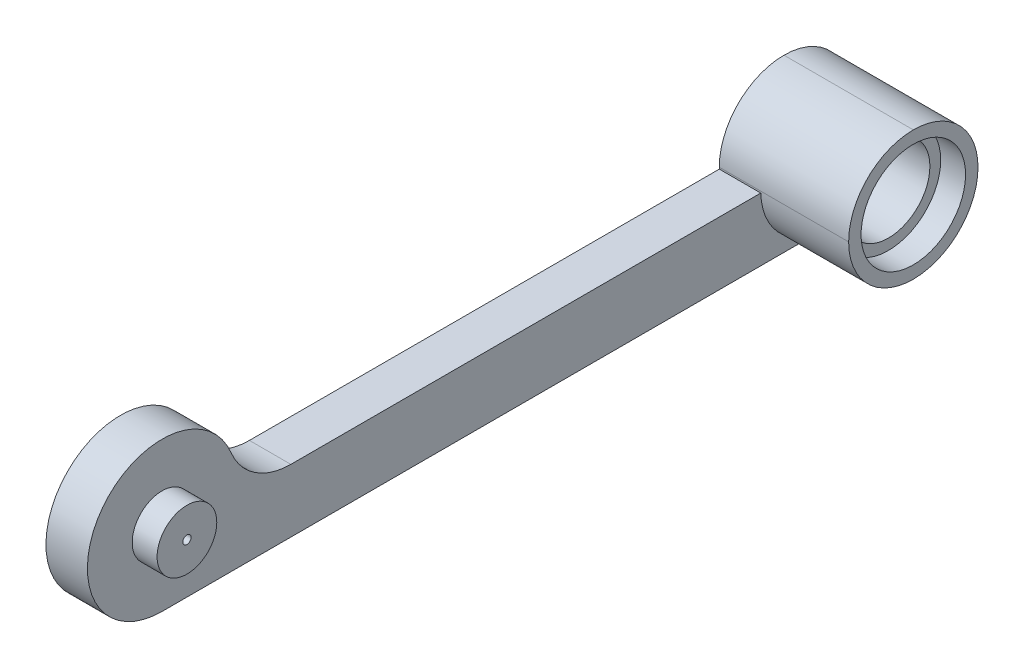
from build123d import *

# Parameters (mm, degrees)
SKETCH_1_R               = 4.5
SKETCH_1_W               = 43.9
SKETCH_1_H               = 7.8
EXTRUDE_1_DEPTH          = 2.5
EXTRUDE_START            = 2.5
SKETCH_1_6_R             = 1.8
SKETCH_1_6_R_2           = 0.25
EXTRUDE_3_DEPTH          = 1.5
SKETCH_1_5_W             = 7.8
SKETCH_1_5_H             = 7.8
EXTRUDE_2_DEPTH          = 7.8
SKETCH_1_7_R             = 2.5
CUT_EXTRUDE_1_DEPTH      = 45.814060294
SKETCH_1_8_R             = 3.15
SKETCH_1_8_R_2           = 2.5
CUT_EXTRUDE_2_DEPTH      = 1.5
CUT_EXTRUDE_START        = 6.3
SKETCH_1_9_R             = 3.15
SKETCH_1_9_R_2           = 2.5
CUT_EXTRUDE_3_DEPTH      = 1.5
CUT_EXTRUDE_4_DEPTH      = 45.814060294
FILLET_1_R               = 3.9
CUT_EXTRUDE_5_DEPTH      = 51.552448012
CUT_EXTRUDE_5_DEPTH_BACK = 51.552448012
SKETCH_3_W               = 64.704037325
SKETCH_3_H               = 20.946447886


with BuildPart() as part:
    # 草图1 → 凸台-拉伸1 (new body)
    with BuildSketch(Plane(origin=(0, 0, 0), x_dir=(0, 0, -1), z_dir=(1, 0, 0))):
        Circle(SKETCH_1_R)
        with Locations((21.95, -0.6)):
            Rectangle(SKETCH_1_W, SKETCH_1_H)
    extrude(amount=EXTRUDE_1_DEPTH)

    # 草图1<6> → 凸台-拉伸3 (add)
    with BuildSketch(Plane(origin=(0, 0, 0), x_dir=(0, 0, -1), z_dir=(1, 0, 0)).offset(EXTRUDE_START)):
        Circle(SKETCH_1_6_R)
        Circle(SKETCH_1_6_R_2, mode=Mode.SUBTRACT)
    extrude(amount=EXTRUDE_3_DEPTH)

    # 草图1<5> → 凸台-拉伸2 (add)
    with BuildSketch(Plane(origin=(0, 0, 0), x_dir=(0, 0, -1), z_dir=(1, 0, 0))):
        with Locations((40, -0.6)):
            Rectangle(SKETCH_1_5_W, SKETCH_1_5_H)
    extrude(amount=EXTRUDE_2_DEPTH)

    # 草图1<7> → 切除-拉伸1 (cut, through all)
    with BuildSketch(Plane(origin=(0, 0, 0), x_dir=(0, 0, -1), z_dir=(1, 0, 0))):
        with Locations((40, -0.6)):
            Circle(SKETCH_1_7_R)
    extrude(amount=CUT_EXTRUDE_1_DEPTH, mode=Mode.SUBTRACT)

    # 草图1<8> → 切除-拉伸2 (cut)
    with BuildSketch(Plane(origin=(0, 0, 0), x_dir=(0, 0, -1), z_dir=(1, 0, 0))):
        with Locations((40, -0.6)):
            Circle(SKETCH_1_8_R)
        with Locations((40, -0.6)):
            Circle(SKETCH_1_8_R_2, mode=Mode.SUBTRACT)
    extrude(amount=CUT_EXTRUDE_2_DEPTH, mode=Mode.SUBTRACT)

    # 草图1<9> → 切除-拉伸3 (cut)
    with BuildSketch(Plane(origin=(0, 0, 0), x_dir=(0, 0, -1), z_dir=(1, 0, 0)).offset(CUT_EXTRUDE_START)):
        with Locations((40, -0.6)):
            Circle(SKETCH_1_9_R)
        with Locations((40, -0.6)):
            Circle(SKETCH_1_9_R_2, mode=Mode.SUBTRACT)
    extrude(amount=CUT_EXTRUDE_3_DEPTH, mode=Mode.SUBTRACT)

    # 草图2 → 切除-拉伸4 (cut, through all)
    with BuildSketch(Plane.ZY):
        Polygon((-4.5, 3.3), (-36.1, 3.3), (-36.1, -0.7), (-4.5, -0.7), (-4.5, 0), align=None)
        with BuildLine():
            Line((-3.059411708, 3.3), (-4.5, 3.3))
            Line((-4.5, 3.3), (-4.5, 0))
            ThreePointArc((-4.5, 0), (-4.124157653, 1.800367645), (-3.059411708, 3.3))
        make_face()
    extrude(amount=-CUT_EXTRUDE_4_DEPTH, mode=Mode.SUBTRACT)

    # 圆角1
    # the kernel refuses this fillet: 3.9 mm, written as the material it adds along each edge
    with BuildSketch(Plane(origin=(0, -0.7, -4.5), x_dir=(0, 0, -1), z_dir=(1, 0, 0))) as fillet_1_piece_1:
        with BuildLine():
            CenterArc((3.266595136, 3.9), FILLET_1_R, 202.392687805, 67.607312195)
            Line((-0.339324035, 2.414285714), (-0.699915952, 2.265714286))
            ThreePointArc((-0.699915952, 2.265714286), (-0.39, 0.7), (-0.39, 0))
            Line((-0.39, 0), (0, -0.39))
            Line((0, -0.39), (3.266595136, -0.39))
            Line((3.266595136, -0.39), (3.266595136, 0))
        make_face()
    extrude(amount=2.5)
    # the kernel refuses this fillet: 3.9 mm, written as the material it takes off along each edge
    with BuildSketch(Plane(origin=(-9.75, -4.5, -43.9), x_dir=(0, 1, 0), z_dir=(1, 0, 0))) as fillet_1_2_piece_1:
        with BuildLine():
            CenterArc((FILLET_1_R, FILLET_1_R), FILLET_1_R, 180, 90)
            Line((0, FILLET_1_R), (0, 0))
            Line((0, 0), (FILLET_1_R, 0))
        make_face()
    extrude(amount=27.3, mode=Mode.SUBTRACT)
    with BuildSketch(Plane(origin=(17.55, 3.3, -43.9), x_dir=(0, 0, 1), z_dir=(-1, 0, 0)), Plane(origin=(17.55, 3.3, -36.1), x_dir=(0, -1, 0), z_dir=(-1, 0, 0))) as fillet_1_2_piece_2:
        with BuildLine():
            CenterArc((FILLET_1_R, -FILLET_1_R), FILLET_1_R, 90, 90)
            Line((0, -FILLET_1_R), (0, 0))
            Line((0, 0), (FILLET_1_R, 0))
        make_face()
    extrude(amount=27.3, mode=Mode.SUBTRACT)
    with BuildSketch(Plane(origin=(-7.25, -4.5, -36.1), x_dir=(0, 1, 0), z_dir=(1, 0, 0))) as fillet_1_2_piece_3_section:
        with BuildLine():
            CenterArc((FILLET_1_R, -FILLET_1_R), FILLET_1_R, 90, 90)
            Line((0, -FILLET_1_R), (0, 0))
            Line((0, 0), (FILLET_1_R, 0))
        make_face()
    fillet_1_2_piece_3 = extrude(amount=24.8, mode=Mode.PRIVATE)
    fillet_1_2_piece_3 = split(fillet_1_2_piece_3, bisect_by=Plane(origin=(1.25, -0.7, -36.100384668), z_dir=(0, 1, 0)), keep=Keep.TOP, mode=Mode.PRIVATE)
    add(fillet_1_2_piece_3, mode=Mode.SUBTRACT)
    with BuildSketch(Plane(origin=(2.5, -4.5, -36.1), x_dir=(0, 1, 0), z_dir=(1, 0, 0))) as fillet_1_2_piece_4:
        with BuildLine():
            CenterArc((FILLET_1_R, -FILLET_1_R), FILLET_1_R, 90, 90)
            Line((0, -FILLET_1_R), (0, 0))
            Line((0, 0), (FILLET_1_R, 0))
        make_face()
    extrude(amount=15.05, mode=Mode.SUBTRACT)


with BuildPart() as body_2:
    # 镜向2: mirrored copy
    add(part.part.mirror(Plane.ZX.offset(-10)))

    # 草图3 → 切除-拉伸5 (cut, two sides: drawn at the far end of the back side and taken through both)
    with BuildSketch(Plane(origin=(2.5, 0, 0), x_dir=(0, 0, -1), z_dir=(1, 0, 0)).offset(-CUT_EXTRUDE_5_DEPTH_BACK)):
        with Locations((21.266459283, -20.282495136)):
            Rectangle(SKETCH_3_W, SKETCH_3_H)
    extrude(amount=CUT_EXTRUDE_5_DEPTH + CUT_EXTRUDE_5_DEPTH_BACK, mode=Mode.SUBTRACT)


solid = part.part
